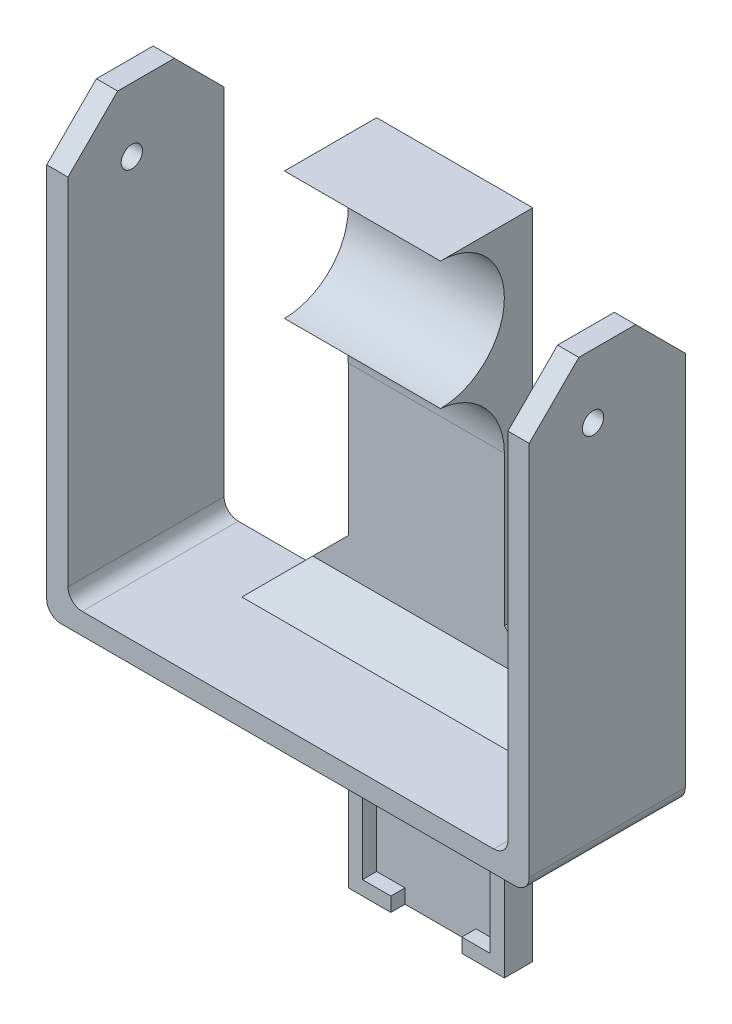
from build123d import *

# Parameters (mm, degrees)
BOSS_EXTRUDE1_DEPTH      = 2
SKETCH2_W                = 22
SKETCH2_H                = 32
BOSS_EXTRUDE2_DEPTH      = 2
BOSS_EXTRUDE3_DEPTH      = 2
BOSS_EXTRUDE3_DEPTH_BACK = 2
SKETCH3_W                = 22
SKETCH3_H                = 60
BOSS_EXTRUDE4_DEPTH      = 18
BOSS_EXTRUDE4_DEPTH_BACK = 4
SKETCH4_W                = 21.5
SKETCH4_H                = 3
SKETCH4_W_2              = 18.5
SKETCH4_W_3              = 3
SKETCH4_H_2              = 59
BOSS_EXTRUDE5_DEPTH      = 22
FILLET1_R                = 10
CHAMFER1_SIZE            = 7
SKETCH6_R                = 1.5
CUT_EXTRUDE1_DEPTH       = 72
FILLET2_R                = 2
CHAMFER2_SIZE            = 10
CHAMFER3_SIZE            = 10
CHAMFER4_SIZE            = 5


with BuildPart() as part:
    # Sketch1 → Boss-Extrude1 (new body)
    with BuildSketch(Plane.XY):
        Polygon((-2, 30), (-2, -2), (4, -2), (4, 0), (0, 0), (0, 28), (18, 28), (18, 0), (14, 0), (14, -2), (20, -2), (20, 30), align=None)
    extrude(amount=BOSS_EXTRUDE1_DEPTH)

    # Sketch2 → Boss-Extrude2 (add)
    with BuildSketch(Plane(origin=(0, 0, 0), x_dir=(-1, 0, 0), z_dir=(0, 0, -1))):
        with Locations((-9, 14)):
            Rectangle(SKETCH2_W, SKETCH2_H)
    extrude(amount=BOSS_EXTRUDE2_DEPTH)

    # Sketch3 → Boss-Extrude3 (add, two sides: drawn at the far end of the back side and taken through both)
    with BuildSketch(Plane.XY.offset(-BOSS_EXTRUDE3_DEPTH_BACK)):
        with Locations((9, 60)):
            Rectangle(SKETCH3_W, SKETCH3_H)
    extrude(amount=BOSS_EXTRUDE3_DEPTH + BOSS_EXTRUDE3_DEPTH_BACK)

    # Sketch4 → Boss-Extrude4 (add, two sides: drawn at the far end of the back side and taken through both)
    with BuildSketch(Plane.XY.offset(2).offset(-BOSS_EXTRUDE4_DEPTH_BACK)):
        Polygon((-23.5, 28), (-23.5, 31), (-23.5, 90), (-26.5, 90), (-26.5, 28), align=None)
        with Locations((-12.75, 29.5)):
            Rectangle(SKETCH4_W, SKETCH4_H)
        with Locations((29.25, 29.5)):
            Rectangle(SKETCH4_W_2, SKETCH4_H)
        with Locations((40, 60.5)):
            Rectangle(SKETCH4_W_3, SKETCH4_H_2)
        Polygon((20, 31), (-2, 31), (-2, 28), (0, 28), (18, 28), (20, 28), align=None)
        with Locations((40, 29.5)):
            Rectangle(SKETCH4_W_3, SKETCH4_H)
    extrude(amount=BOSS_EXTRUDE4_DEPTH + BOSS_EXTRUDE4_DEPTH_BACK)

    # Sketch5 → Boss-Extrude5 (add)
    with BuildSketch(Plane(origin=(20, 0, 0), x_dir=(0, 0, -1), z_dir=(1, 0, 0))):
        with BuildLine():
            ThreePointArc((-2, 81), (-4.636038969, 74.636038969), (-11, 72))
            Line((-11, 72), (-2, 72))
            Line((-2, 72), (-2, 81))
        make_face()
        with BuildLine():
            Line((-2, 90), (-11, 90))
            ThreePointArc((-11, 90), (-4.636038969, 87.363961031), (-2, 81))
            Line((-2, 81), (-2, 90))
        make_face()
    extrude(amount=-BOSS_EXTRUDE5_DEPTH)

    # Fillet1
    # the kernel refuses this fillet: 10 mm, written as the material it adds along each edge
    with BuildSketch(Plane(origin=(20, 72, 2), x_dir=(0, 0, 1), z_dir=(-1, 0, 0))) as fillet1_piece_1_section:
        with BuildLine():
            CenterArc((10, -9.949874371), FILLET1_R, 95.739170477, 84.260829523)
            Line((0, -9.949874371), (-0.2, -9.949874371))
            Line((-0.2, -9.949874371), (-0.2, 0))
            Line((-0.2, 0), (0, 0.2))
            ThreePointArc((0, 0.2), (4.5, 0.2), (8.98, 0.198997487))
            Line((8.98, 0.198997487), (9, 0))
        make_face()
    fillet1_piece_1 = extrude(amount=22, mode=Mode.PRIVATE)
    fillet1_piece_1 = fillet1_piece_1 - Plane(origin=(9, 81, 11), x_dir=(0, 0, -1), z_dir=(1, 0, 0)) * Cylinder(9, 84, mode=Mode.PRIVATE)
    add(fillet1_piece_1)

    # Chamfer1
    chamfer1_edges = [part.edges().sort_by_distance(p)[0] for p in [
        (40, 90, -2),
        (-25, 90, -2),
        (-25, 90, 20),
        (40, 90, 20),
    ]]
    chamfer(chamfer1_edges, length=CHAMFER1_SIZE)

    # Sketch6 → Cut-Extrude1 (cut)
    with BuildSketch(Plane(origin=(41.5, 0, 0), x_dir=(0, 0, -1), z_dir=(1, 0, 0))):
        with Locations((-11, 81)):
            Circle(SKETCH6_R)
    extrude(amount=-CUT_EXTRUDE1_DEPTH, mode=Mode.SUBTRACT)

    # Fillet2
    fillet2_edges = [part.edges().sort_by_distance(p)[0] for p in [
        (38.5, 31, 9),
        (41.5, 28, 9),
        (-26.5, 28, 9),
        (-23.5, 31, 9),
    ]]
    fillet(fillet2_edges, radius=FILLET2_R)

    # Chamfer2
    chamfer2_edges = [part.edges().sort_by_distance(p)[0] for p in [
        (20, 28, 0),
        (-2, 28, 0),
    ]]
    chamfer(chamfer2_edges, length=CHAMFER2_SIZE)

    # Chamfer3
    chamfer3_edges = [part.edges().sort_by_distance(p)[0] for p in [
        (-2, 31, 0),
        (20, 31, 0),
    ]]
    chamfer(chamfer3_edges, length=CHAMFER3_SIZE)

    # Chamfer4
    chamfer4_edges = [part.edges().sort_by_distance(p)[0] for p in [
        (9, 31, 2),
    ]]
    chamfer(chamfer4_edges, length=CHAMFER4_SIZE)


solid = part.part
